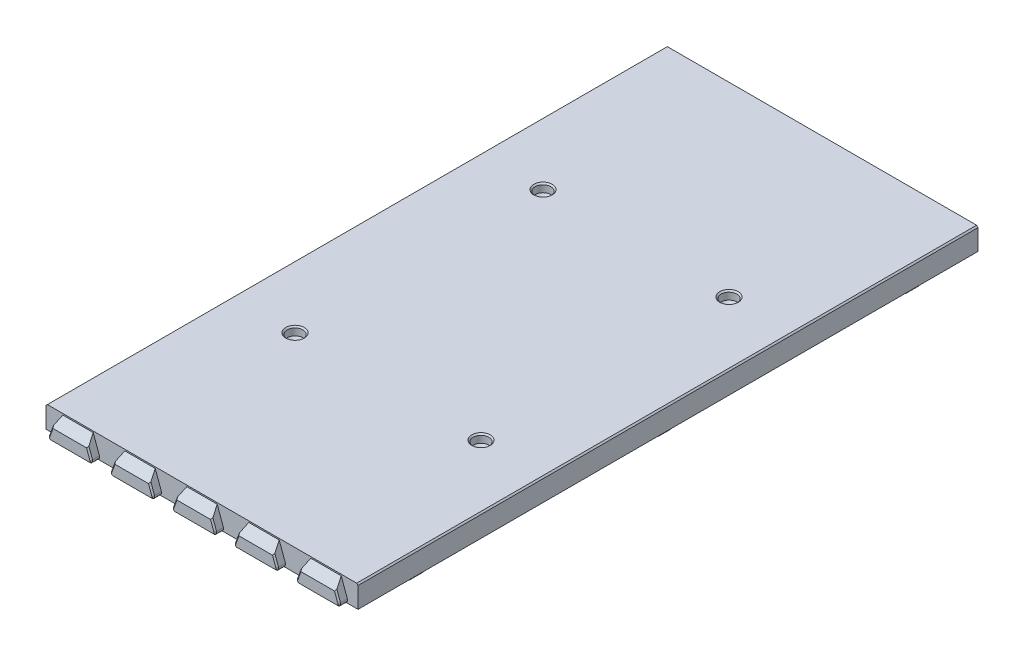
from build123d import *

# Parameters (mm, degrees)
BOSS_EXTRUDE1_DEPTH             = 112.5
SKETCH7_W                       = 109.25
SKETCH7_H                       = 6
BOSS_EXTRUDE7_DEPTH             = 1
BOSS_EXTRUDE4_DEPTH             = 3
BOSS_EXTRUDE8_REACH             = 128.201
BOSS_EXTRUDE8_DIRECTION_2_DEPTH = 2
CHAMFER4_SIZE                   = 0.5
FILLET4_R                       = 1
CHAMFER6_SIZE                   = 0.5
FILLET2_R                       = 2
CHAMFER4_OF_MIRROR2_SIZE        = 0.5
FILLET4_OF_MIRROR2_R            = 1
CHAMFER6_OF_MIRROR2_SIZE        = 0.5
FILLET2_OF_MIRROR2_R            = 2
BOSS_EXTRUDE9_REACH             = 237.063
SKETCH9_R                       = 5
FILLET3_R                       = 3
SKETCH10_R                      = 1.85
CUT_EXTRUDE2_DEPTH              = 236.062524927
SKETCH11_R                      = 2.85
CUT_EXTRUDE3_DEPTH              = 3
CHAMFER7_SIZE                   = 1
CUT_EXTRUDE4_DEPTH              = 236.062524927
CUT_EXTRUDE4_DEPTH_BACK         = 236.062524927
CHAMFER8_SIZE                   = 0.5


with BuildPart() as part:
    # Sketch1 → Boss-Extrude1 (new body)
    with BuildSketch(Plane.XY):
        Polygon((-56.625, 0), (-56.625, 8), (56.625, 8), (56.625, 0), (54.625, 0), (54.625, 6), (-54.625, 6), (-54.625, 0), align=None)
    boss_extrude1 = extrude(amount=-BOSS_EXTRUDE1_DEPTH)

    # Sketch7 → Boss-Extrude7 (add)
    with BuildSketch(Plane.XY):
        with Locations((0, 3)):
            Rectangle(SKETCH7_W, SKETCH7_H)
    boss_extrude7 = extrude(amount=-BOSS_EXTRUDE7_DEPTH)

    # Sketch2 → Boss-Extrude4 (add)
    with BuildSketch(Plane.XY):
        Polygon((39.661761874, 8), (36.75, 0), (53.25, 0), (50.338238126, 8), align=None)
        Polygon((17.161761874, 8), (14.25, 0), (30.75, 0), (27.838238126, 8), align=None)
        Polygon((-5.338238126, 8), (-8.25, 0), (8.25, 0), (5.338238126, 8), align=None)
        Polygon((-27.838238126, 8), (-30.75, 0), (-14.25, 0), (-17.161761874, 8), align=None)
        Polygon((-50.338238126, 8), (-53.25, 0), (-36.75, 0), (-39.661761874, 8), align=None)
    boss_extrude4 = extrude(amount=BOSS_EXTRUDE4_DEPTH)

    # Sketch8 → Boss-Extrude8 (add, up to next)
    with BuildSketch(Plane.XZ, mode=Mode.PRIVATE) as boss_extrude8_sk1:
        Polygon((-55.25, -24.955880937), (-55.25, -20.044119063), (-51.25, -21.5), (-51.25, -23.5), align=None)
    boss_extrude8_tool1 = extrude(boss_extrude8_sk1.sketch, amount=-BOSS_EXTRUDE8_REACH, mode=Mode.PRIVATE) - part.part
    # Sketch8 → Boss-Extrude8 (add, up to next)
    with BuildSketch(Plane.XZ, mode=Mode.PRIVATE) as boss_extrude8_sk2:
        Polygon((-55.25, -112.5), (-55.25, -110.044119063), (-51.25, -111.5), (-51.25, -112.5), align=None)
    boss_extrude8_tool2 = extrude(boss_extrude8_sk2.sketch, amount=-BOSS_EXTRUDE8_REACH, mode=Mode.PRIVATE) - part.part
    # Sketch8 → Boss-Extrude8 (add, up to next)
    with BuildSketch(Plane.XZ, mode=Mode.PRIVATE) as boss_extrude8_sk3:
        Polygon((55.25, -24.955880937), (51.25, -23.5), (51.25, -21.5), (55.25, -20.044119063), align=None)
    boss_extrude8_tool3 = extrude(boss_extrude8_sk3.sketch, amount=-BOSS_EXTRUDE8_REACH, mode=Mode.PRIVATE) - part.part
    # Sketch8 → Boss-Extrude8 (add, up to next)
    with BuildSketch(Plane.XZ, mode=Mode.PRIVATE) as boss_extrude8_sk4:
        Polygon((51.25, -112.5), (55.25, -112.5), (55.25, -110.044119063), (51.25, -111.5), align=None)
    boss_extrude8_tool4 = extrude(boss_extrude8_sk4.sketch, amount=-BOSS_EXTRUDE8_REACH, mode=Mode.PRIVATE) - part.part
    boss_extrude8_1 = boss_extrude8_tool1.solids().sort_by_distance((-53.530851, 0, -22.5))[0]
    add(boss_extrude8_1)
    boss_extrude8_2 = boss_extrude8_tool2.solids().sort_by_distance((-53.530851, 0, -111.584919))[0]
    add(boss_extrude8_2)
    boss_extrude8_3 = boss_extrude8_tool3.solids().sort_by_distance((53.530851, 0, -22.5))[0]
    add(boss_extrude8_3)
    boss_extrude8_4 = boss_extrude8_tool4.solids().sort_by_distance((53.530851, 0, -111.584919))[0]
    add(boss_extrude8_4)
    boss_extrude8 = boss_extrude8_1 + boss_extrude8_2 + boss_extrude8_3 + boss_extrude8_4  # Boss-Extrude8 as one shape, for the pattern or mirror that repeats it

    # Sketch8 → Boss-Extrude8 direction 2 (add)
    with BuildSketch(Plane.XZ):
        Polygon((-55.25, -24.955880937), (-55.25, -20.044119063), (-51.25, -21.5), (-51.25, -23.5), align=None)
        Polygon((-55.25, -112.5), (-55.25, -110.044119063), (-51.25, -111.5), (-51.25, -112.5), align=None)
        Polygon((55.25, -24.955880937), (51.25, -23.5), (51.25, -21.5), (55.25, -20.044119063), align=None)
        Polygon((51.25, -112.5), (55.25, -112.5), (55.25, -110.044119063), (51.25, -111.5), align=None)
    boss_extrude8_direction_2 = extrude(amount=BOSS_EXTRUDE8_DIRECTION_2_DEPTH)

    # Chamfer4
    chamfer4_edges = [part.edges().sort_by_distance(p)[0] for p in [
        (-51.25, -2, -112),
        (-53.25, -2, -110.772059531),
        (-55.25, -2, -111.272059531),
        (-53.25, -2, -20.772059531),
        (-55.25, -2, -22.5),
        (-53.25, -2, -24.227940469),
        (-51.25, -2, -22.5),
        (55.25, -2, -22.5),
        (53.25, -2, -20.772059531),
        (51.25, -2, -22.5),
        (53.25, -2, -24.227940469),
        (51.25, -2, -112),
        (55.25, -2, -111.272059531),
        (53.25, -2, -110.772059531),
    ]]
    chamfer(chamfer4_edges, length=CHAMFER4_SIZE)

    # Fillet4
    fillet4_edges = [part.edges().sort_by_distance(p)[0] for p in [
        (36.75, 0, 1.5),
        (53.25, 0, 1.5),
        (14.25, 0, 1.5),
        (30.75, 0, 1.5),
        (-8.25, 0, 1.5),
        (8.25, 0, 1.5),
        (-53.25, 0, 1.5),
        (-36.75, 0, 1.5),
        (-30.75, 0, 1.5),
        (-14.25, 0, 1.5),
    ]]
    fillet(fillet4_edges, radius=FILLET4_R)

    # Chamfer6
    chamfer6_edges = [part.edges().sort_by_distance(p)[0] for p in [
        (51.54989137, 4.671010072, 3),
        (45, 0, 3),
        (22.5, 0, 3),
        (0, 0, 3),
        (-22.5, 0, 3),
        (-45, 0, 3),
        (37.358995962, 0.426423564, 3),
        (52.641004038, 0.426423564, 3),
        (29.04989137, 4.671010072, 3),
        (14.858995962, 0.426423564, 3),
        (30.141004038, 0.426423564, 3),
        (6.54989137, 4.671010072, 3),
        (-7.641004038, 0.426423564, 3),
        (7.641004038, 0.426423564, 3),
        (-15.95010863, 4.671010072, 3),
        (-30.141004038, 0.426423564, 3),
        (-14.858995962, 0.426423564, 3),
        (-38.45010863, 4.671010072, 3),
        (-52.641004038, 0.426423564, 3),
        (-37.358995962, 0.426423564, 3),
        (38.45010863, 4.671010072, 3),
        (15.95010863, 4.671010072, 3),
        (-6.54989137, 4.671010072, 3),
        (-51.54989137, 4.671010072, 3),
        (-29.04989137, 4.671010072, 3),
    ]]
    chamfer(chamfer6_edges, length=CHAMFER6_SIZE)

    # Fillet2
    fillet2_edges = [part.edges().sort_by_distance(p)[0] for p in [
        (-54.625, 6, -67.5),
        (-54.625, 3, -110.271600459),
        (-51.25, 6, -112),
        (-52.9375, 6, -110.88580023),
        (-54.625, 6, -10.63580023),
        (-54.625, 3, -20.271600459),
        (-54.625, 3, -24.728399541),
        (-52.9375, 6, -20.88580023),
        (-51.25, 6, -22.5),
        (-52.9375, 6, -24.11419977),
        (54.625, 6, -10.63580023),
        (54.625, 3, -20.271600459),
        (54.625, 3, -24.728399541),
        (52.9375, 6, -20.88580023),
        (52.9375, 6, -24.11419977),
        (51.25, 6, -22.5),
        (54.625, 6, -67.5),
        (54.625, 3, -110.271600459),
        (51.25, 6, -112),
        (52.9375, 6, -110.88580023),
        (-54.625, 3, -1),
        (0, 6, -1),
        (54.625, 3, -1),
    ]]
    fillet(fillet2_edges, radius=FILLET2_R)


with BuildPart() as mirror2_1:
    # Mirror2: Boss-Extrude1, Boss-Extrude7, Boss-Extrude4, Boss-Extrude8, Boss-Extrude8 direction 2 across plane
    add(boss_extrude1.mirror(Plane.XY.offset(-112.5)))
    add(boss_extrude7.mirror(Plane.XY.offset(-112.5)))
    add(boss_extrude4.mirror(Plane.XY.offset(-112.5)))
    add(boss_extrude8.mirror(Plane.XY.offset(-112.5)))
    add(boss_extrude8_direction_2.mirror(Plane.XY.offset(-112.5)))

    # Chamfer4 of Mirror2
    chamfer4_of_mirror2_edges = [mirror2_1.edges().sort_by_distance(p)[0] for p in [
        (-51.25, -2, -113),
        (-53.25, -2, -114.227940469),
        (-55.25, -2, -113.727940469),
        (-53.25, -2, -204.227940469),
        (-55.25, -2, -202.5),
        (-53.25, -2, -200.772059531),
        (-51.25, -2, -202.5),
        (55.25, -2, -202.5),
        (53.25, -2, -204.227940469),
        (51.25, -2, -202.5),
        (53.25, -2, -200.772059531),
        (51.25, -2, -113),
        (55.25, -2, -113.727940469),
        (53.25, -2, -114.227940469),
    ]]
    chamfer(chamfer4_of_mirror2_edges, length=CHAMFER4_OF_MIRROR2_SIZE)

    # Fillet4 of Mirror2
    fillet4_of_mirror2_edges = [mirror2_1.edges().sort_by_distance(p)[0] for p in [
        (36.75, 0, -226.5),
        (53.25, 0, -226.5),
        (14.25, 0, -226.5),
        (30.75, 0, -226.5),
        (-8.25, 0, -226.5),
        (8.25, 0, -226.5),
        (-53.25, 0, -226.5),
        (-36.75, 0, -226.5),
        (-30.75, 0, -226.5),
        (-14.25, 0, -226.5),
    ]]
    fillet(fillet4_of_mirror2_edges, radius=FILLET4_OF_MIRROR2_R)

    # Chamfer6 of Mirror2
    chamfer6_of_mirror2_edges = [mirror2_1.edges().sort_by_distance(p)[0] for p in [
        (51.54989137, 4.671010072, -228),
        (45, 0, -228),
        (22.5, 0, -228),
        (0, 0, -228),
        (-22.5, 0, -228),
        (-45, 0, -228),
        (37.358995962, 0.426423564, -228),
        (52.641004038, 0.426423564, -228),
        (29.04989137, 4.671010072, -228),
        (14.858995962, 0.426423564, -228),
        (30.141004038, 0.426423564, -228),
        (6.54989137, 4.671010072, -228),
        (-7.641004038, 0.426423564, -228),
        (7.641004038, 0.426423564, -228),
        (-15.95010863, 4.671010072, -228),
        (-30.141004038, 0.426423564, -228),
        (-14.858995962, 0.426423564, -228),
        (-38.45010863, 4.671010072, -228),
        (-52.641004038, 0.426423564, -228),
        (-37.358995962, 0.426423564, -228),
        (38.45010863, 4.671010072, -228),
        (15.95010863, 4.671010072, -228),
        (-6.54989137, 4.671010072, -228),
        (-51.54989137, 4.671010072, -228),
        (-29.04989137, 4.671010072, -228),
    ]]
    chamfer(chamfer6_of_mirror2_edges, length=CHAMFER6_OF_MIRROR2_SIZE)

    # Fillet2 of Mirror2
    fillet2_of_mirror2_edges = [mirror2_1.edges().sort_by_distance(p)[0] for p in [
        (-54.625, 6, -157.5),
        (-54.625, 3, -114.728399541),
        (-51.25, 6, -113),
        (-52.9375, 6, -114.11419977),
        (-54.625, 6, -214.36419977),
        (-54.625, 3, -204.728399541),
        (-54.625, 3, -200.271600459),
        (-52.9375, 6, -204.11419977),
        (-51.25, 6, -202.5),
        (-52.9375, 6, -200.88580023),
        (54.625, 6, -214.36419977),
        (54.625, 3, -204.728399541),
        (54.625, 3, -200.271600459),
        (52.9375, 6, -204.11419977),
        (52.9375, 6, -200.88580023),
        (51.25, 6, -202.5),
        (54.625, 6, -157.5),
        (54.625, 3, -114.728399541),
        (51.25, 6, -113),
        (52.9375, 6, -114.11419977),
        (-54.625, 3, -224),
        (0, 6, -224),
        (54.625, 3, -224),
    ]]
    fillet(fillet2_of_mirror2_edges, radius=FILLET2_OF_MIRROR2_R)


with BuildPart() as part_1:
    add(part.part)

    # Mirror2 united with what the copies touc: union Mirror2_1
    add(mirror2_1.part)

    # Sketch9 → Boss-Extrude9 (add, up to next)
    with BuildSketch(Plane(origin=(0, 0, 0), x_dir=(1, 0, 0), z_dir=(0, 1, 0)), mode=Mode.PRIVATE) as boss_extrude9_sk1:
        with Locations(Location((-33.75, 67.5, 0), (0, 0, 90))):
            Circle(SKETCH9_R)
    boss_extrude9_tool1 = extrude(boss_extrude9_sk1.sketch, amount=BOSS_EXTRUDE9_REACH, mode=Mode.PRIVATE) - part_1.part
    # Sketch9 → Boss-Extrude9 (add, up to next)
    with BuildSketch(Plane(origin=(0, 0, 0), x_dir=(1, 0, 0), z_dir=(0, 1, 0)), mode=Mode.PRIVATE) as boss_extrude9_sk2:
        with Locations(Location((33.75, 67.5, 0), (0, 0, 90))):
            Circle(SKETCH9_R)
    boss_extrude9_tool2 = extrude(boss_extrude9_sk2.sketch, amount=BOSS_EXTRUDE9_REACH, mode=Mode.PRIVATE) - part_1.part
    # Sketch9 → Boss-Extrude9 (add, up to next)
    with BuildSketch(Plane(origin=(0, 0, 0), x_dir=(1, 0, 0), z_dir=(0, 1, 0)), mode=Mode.PRIVATE) as boss_extrude9_sk3:
        with Locations(Location((33.75, 157.5, 0), (0, 0, 90))):
            Circle(SKETCH9_R)
    boss_extrude9_tool3 = extrude(boss_extrude9_sk3.sketch, amount=BOSS_EXTRUDE9_REACH, mode=Mode.PRIVATE) - part_1.part
    # Sketch9 → Boss-Extrude9 (add, up to next)
    with BuildSketch(Plane(origin=(0, 0, 0), x_dir=(1, 0, 0), z_dir=(0, 1, 0)), mode=Mode.PRIVATE) as boss_extrude9_sk4:
        with Locations(Location((-33.75, 157.5, 0), (0, 0, 90))):
            Circle(SKETCH9_R)
    boss_extrude9_tool4 = extrude(boss_extrude9_sk4.sketch, amount=BOSS_EXTRUDE9_REACH, mode=Mode.PRIVATE) - part_1.part
    add(boss_extrude9_tool1.solids().sort_by_distance((-33.75, 0, -67.5))[0])
    add(boss_extrude9_tool2.solids().sort_by_distance((33.75, 0, -67.5))[0])
    add(boss_extrude9_tool3.solids().sort_by_distance((33.75, 0, -157.5))[0])
    add(boss_extrude9_tool4.solids().sort_by_distance((-33.75, 0, -157.5))[0])

    # Fillet3
    fillet3_edges = [part_1.edges().sort_by_distance(p)[0] for p in [
        (-33.75, 6, -62.5),
        (-33.75, 6, -152.5),
        (33.75, 6, -152.5),
        (33.75, 6, -62.5),
    ]]
    fillet(fillet3_edges, radius=FILLET3_R)

    # Sketch10 → Cut-Extrude2 (cut, through all)
    with BuildSketch(Plane(origin=(0, 0, 0), x_dir=(1, 0, 0), z_dir=(0, 1, 0))):
        with Locations(Location((-33.75, 157.5, 0), (0, 0, 270))):
            Circle(SKETCH10_R)
        with Locations(Location((-33.75, 67.5, 0), (0, 0, 270))):
            Circle(SKETCH10_R)
        with Locations(Location((33.75, 67.5, 0), (0, 0, 270))):
            Circle(SKETCH10_R)
        with Locations(Location((33.75, 157.5, 0), (0, 0, 270))):
            Circle(SKETCH10_R)
    extrude(amount=CUT_EXTRUDE2_DEPTH, mode=Mode.SUBTRACT)

    # Sketch11 → Cut-Extrude3 (cut)
    with BuildSketch(Plane(origin=(0, 8, 0), x_dir=(1, 0, 0), z_dir=(0, 1, 0))):
        with Locations(Location((-33.75, 157.5, 0), (0, 0, 270))):
            Circle(SKETCH11_R)
        with Locations(Location((33.75, 157.5, 0), (0, 0, 270))):
            Circle(SKETCH11_R)
        with Locations(Location((33.75, 67.5, 0), (0, 0, 270))):
            Circle(SKETCH11_R)
        with Locations(Location((-33.75, 67.5, 0), (0, 0, 270))):
            Circle(SKETCH11_R)
    extrude(amount=-CUT_EXTRUDE3_DEPTH, mode=Mode.SUBTRACT)

    # Chamfer7
    chamfer7_edges = [part_1.edges().sort_by_distance(p)[0] for p in [
        (-33.75, 5, -69.35),
        (33.75, 5, -69.35),
        (33.75, 5, -159.35),
        (-33.75, 5, -159.35),
    ]]
    chamfer(chamfer7_edges, length=CHAMFER7_SIZE - 0.0001)  # a hair under: the kernel refuses the full size

    # Sketch12 → Cut-Extrude4 (cut, two sides: drawn at the far end of the back side and taken through both)
    with BuildSketch(Plane(origin=(0, 0, 0), x_dir=(0, 0, -1), z_dir=(1, 0, 0)).offset(-CUT_EXTRUDE4_DEPTH_BACK)):
        Polygon((0, 7.5), (-3, 4.5), (-3, 7.5), (-3, 8), (0, 8), align=None)
        Polygon((228, 8), (228, 7.5), (228, 4.5), (225, 7.5), (225, 8), align=None)
    extrude(amount=CUT_EXTRUDE4_DEPTH + CUT_EXTRUDE4_DEPTH_BACK, mode=Mode.SUBTRACT)

    # Chamfer8
    chamfer8_edges = [part_1.edges().sort_by_distance(p)[0] for p in [
        (-56.625, 8, -112.5),
        (56.625, 8, -112.5),
        (-33.75, 8, -70.35),
        (33.75, 8, -70.35),
        (33.75, 8, -160.35),
        (-33.75, 8, -160.35),
    ]]
    chamfer(chamfer8_edges, length=CHAMFER8_SIZE)


solid = part_1.part
